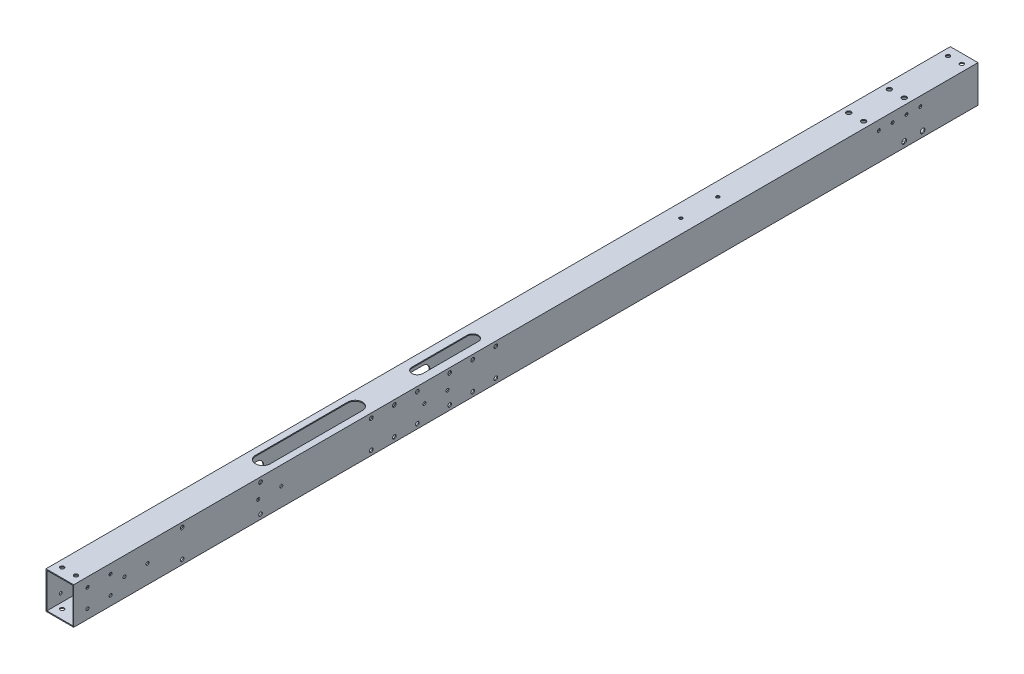
from build123d import *

# Parameters (mm, degrees)
SKETCH_1_W           = 30
SKETCH_1_H           = 40
SKETCH_1_W_2         = 28
SKETCH_1_H_2         = 38
EXTRUDE_1_DEPTH      = 940
SKETCH_5_R           = 2.5
CUT_EXTRUDE_3_DEPTH  = 941.97024395
CUT_EXTRUDE_4_DEPTH  = 1
SKETCH_7_R           = 1.5
CUT_EXTRUDE_5_DEPTH  = 1
SKETCH_17_W          = 30
SKETCH_17_H          = 40
SKETCH_17_W_2        = 28
SKETCH_17_H_2        = 38
EXTRUDE_2_DEPTH      = 20
SKETCH_18_W          = 30
SKETCH_18_H          = 40
SKETCH_18_W_2        = 28
SKETCH_18_H_2        = 38
EXTRUDE_3_DEPTH      = 20
SKETCH_19_R          = 2.1
CUT_EXTRUDE_16_DEPTH = 961.950050731
SKETCH_20_R          = 1.6
CUT_EXTRUDE_17_DEPTH = 961.67684473
SKETCH_21_R          = 2.5
SKETCH_21_R_2        = 1.6
CUT_EXTRUDE_18_DEPTH = 961.67684473
SKETCH_23_R          = 2.5
CUT_EXTRUDE_19_DEPTH = 961.950050731
SKETCH_24_R          = 4.5
CUT_EXTRUDE_20_DEPTH = 10
SKETCH_25_W          = 114.67616049
SKETCH_25_H          = 1154.562704257
CUT_EXTRUDE_21_DEPTH = 968.690549711
SKETCH_26_R          = 2
CUT_EXTRUDE_22_DEPTH = 961.67684473
CUT_EXTRUDE_23_DEPTH = 10
SKETCH_29_R          = 1.5
CUT_EXTRUDE_25_DEPTH = 10
CUT_EXTRUDE_26_DEPTH = 10
SKETCH_31_R          = 1.75
CUT_EXTRUDE_27_DEPTH = 10
SKETCH_34_W          = 70
SKETCH_34_H          = 15
CUT_EXTRUDE_28_DEPTH = 10
EXTRUDE_4_DEPTH      = 1
SKETCH_36_W          = 50.706907747
SKETCH_36_H          = 15.381529857
EXTRUDE_5_DEPTH      = 1
FILLET_1_R           = 3
SKETCH_37_R          = 1.75
CUT_EXTRUDE_29_DEPTH = 81
SKETCH_39_W          = 33.04876618
SKETCH_39_H          = 8.235453061
SKETCH_39_W_2        = 28.839368921
SKETCH_39_H_2        = 9.938064258
EXTRUDE_6_DEPTH      = 1
SKETCH_41_W          = 53.968695117
SKETCH_41_H          = 20.437849039
SKETCH_41_W_2        = 57.741002254
SKETCH_41_H_2        = 19.227533359
EXTRUDE_7_DEPTH      = 1
SKETCH_38_R          = 1.65
CUT_EXTRUDE_30_DEPTH = 93
CUT_EXTRUDE_31_DEPTH = 1
SKETCH_43_R          = 1.15
CUT_EXTRUDE_32_DEPTH = 1


with BuildPart() as part:
    # 草图1 → 凸台-拉伸1 (new body)
    with BuildSketch(Plane.XY):
        Rectangle(SKETCH_1_W, SKETCH_1_H)
        Rectangle(SKETCH_1_W_2, SKETCH_1_H_2, mode=Mode.SUBTRACT)
    extrude(amount=EXTRUDE_1_DEPTH)

    # 草图5 → 切除-拉伸3 (cut, through all)
    with BuildSketch(Plane.XZ.offset(20)):
        with Locations((-8, 53)):
            Circle(SKETCH_5_R)
        with Locations((8, 53)):
            Circle(SKETCH_5_R)
        with Locations((-8, 97)):
            Circle(SKETCH_5_R)
        with Locations((8, 97)):
            Circle(SKETCH_5_R)
    extrude(amount=-CUT_EXTRUDE_3_DEPTH, mode=Mode.SUBTRACT)

    # 草图6 → 切除-拉伸4 (cut)
    with BuildSketch(Plane(origin=(15, 0, 0), x_dir=(0, 0, -1), z_dir=(1, 0, 0))):
        with BuildLine():
            Line((-345, -7.5), (-375, -7.5))
            ThreePointArc((-375, -7.5), (-382.5, 0), (-375, 7.5))
            Line((-375, 7.5), (-345, 7.5))
            ThreePointArc((-345, 7.5), (-337.5, 0), (-345, -7.5))
        make_face()
        with BuildLine():
            Line((-525, -7.5), (-555, -7.5))
            ThreePointArc((-555, -7.5), (-562.5, 0), (-555, 7.5))
            Line((-555, 7.5), (-525, 7.5))
            ThreePointArc((-525, 7.5), (-517.5, 0), (-525, -7.5))
        make_face()
        with BuildLine():
            Line((-705, -7.5), (-735, -7.5))
            ThreePointArc((-735, -7.5), (-742.5, 0), (-735, 7.5))
            Line((-735, 7.5), (-705, 7.5))
            ThreePointArc((-705, 7.5), (-697.5, 0), (-705, -7.5))
        make_face()
    extrude(amount=-CUT_EXTRUDE_4_DEPTH, mode=Mode.SUBTRACT)

    # 草图7 → 切除-拉伸5 (cut)
    with BuildSketch(Plane.ZY.offset(15)):
        with Locations((350, 0)):
            Circle(SKETCH_7_R)
        with Locations((370, 0)):
            Circle(SKETCH_7_R)
        with Locations((530, 0)):
            Circle(SKETCH_7_R)
        with Locations((550, 0)):
            Circle(SKETCH_7_R)
        with Locations((710, 0)):
            Circle(SKETCH_7_R)
        with Locations((730, 0)):
            Circle(SKETCH_7_R)
    extrude(amount=-CUT_EXTRUDE_5_DEPTH, mode=Mode.SUBTRACT)

    # 草图17 → 凸台-拉伸2 (add)
    with BuildSketch(Plane.XY.offset(940)):
        Rectangle(SKETCH_17_W, SKETCH_17_H)
        Rectangle(SKETCH_17_W_2, SKETCH_17_H_2, mode=Mode.SUBTRACT)
    extrude(amount=EXTRUDE_2_DEPTH)

    # 草图18 → 凸台-拉伸3 (add)
    with BuildSketch(Plane(origin=(0, 0, 0), x_dir=(-1, 0, 0), z_dir=(0, 0, -1))):
        Rectangle(SKETCH_18_W, SKETCH_18_H)
        Rectangle(SKETCH_18_W_2, SKETCH_18_H_2, mode=Mode.SUBTRACT)
    extrude(amount=EXTRUDE_3_DEPTH)

    # 草图19 → 切除-拉伸16 (cut, through all)
    with BuildSketch(Plane(origin=(0, 20, 0), x_dir=(1, 0, 0), z_dir=(0, 1, 0))):
        with Locations((-7.5, -950)):
            Circle(SKETCH_19_R)
        with Locations((7.5, -950)):
            Circle(SKETCH_19_R)
        with Locations((-7.5, 10)):
            Circle(SKETCH_19_R)
        with Locations((7.5, 10)):
            Circle(SKETCH_19_R)
    extrude(amount=-CUT_EXTRUDE_16_DEPTH, mode=Mode.SUBTRACT)

    # 草图20 → 切除-拉伸17 (cut, through all)
    with BuildSketch(Plane(origin=(15, 0, 0), x_dir=(0, 0, -1), z_dir=(1, 0, 0))):
        with Locations((-945, 10)):
            Circle(SKETCH_20_R)
        with Locations((-920, 10)):
            Circle(SKETCH_20_R)
        with Locations((-920, -10)):
            Circle(SKETCH_20_R)
        with Locations((-945, -10)):
            Circle(SKETCH_20_R)
    extrude(amount=-CUT_EXTRUDE_17_DEPTH, mode=Mode.SUBTRACT)

    # 草图21 → 切除-拉伸18 (cut, through all)
    with BuildSketch(Plane(origin=(15, 0, 0), x_dir=(0, 0, -1), z_dir=(1, 0, 0))):
        with Locations((-40, -14)):
            Circle(SKETCH_21_R)
        with Locations((-60, -14)):
            Circle(SKETCH_21_R)
        with Locations((-42.5, 10)):
            Circle(SKETCH_21_R_2)
        with Locations((-57.5, 10)):
            Circle(SKETCH_21_R_2)
        with Locations((-72.5, 10)):
            Circle(SKETCH_21_R_2)
        with Locations((-87.5, 10)):
            Circle(SKETCH_21_R_2)
    extrude(amount=-CUT_EXTRUDE_18_DEPTH, mode=Mode.SUBTRACT)

    # 草图23 → 切除-拉伸19 (cut, through all)
    with BuildSketch(Plane(origin=(0, 20, 0), x_dir=(1, 0, 0), z_dir=(0, 1, 0))):
        with Locations((0, -520)):
            Circle(SKETCH_23_R)
        with Locations((0, -535)):
            Circle(SKETCH_23_R)
        with Locations((0, -550)):
            Circle(SKETCH_23_R)
        with Locations((0, -565)):
            Circle(SKETCH_23_R)
    extrude(amount=-CUT_EXTRUDE_19_DEPTH, mode=Mode.SUBTRACT)

    # 草图24 → 切除-拉伸20 (cut)
    with BuildSketch(Plane(origin=(0, 20, 0), x_dir=(1, 0, 0), z_dir=(0, 1, 0))):
        with Locations((0, -520)):
            Circle(SKETCH_24_R)
        with Locations((0, -535)):
            Circle(SKETCH_24_R)
        with Locations((0, -550)):
            Circle(SKETCH_24_R)
        with Locations((0, -565)):
            Circle(SKETCH_24_R)
    extrude(amount=-CUT_EXTRUDE_20_DEPTH, mode=Mode.SUBTRACT)


with BuildPart() as body_2:
    # 镜向2: mirrored copy
    add(part.part.mirror(Plane(origin=(-50, 0, 0), x_dir=(0, 0, 1), z_dir=(1, 0, 0))))

    # 草图26 → 切除-拉伸22 (cut, through all)
    with BuildSketch(Plane.ZY.offset(115)):
        with Locations((612.5, 15)):
            Circle(SKETCH_26_R)
        with Locations((612.5, -15)):
            Circle(SKETCH_26_R)
        with Locations((527.5, 15)):
            Circle(SKETCH_26_R)
        with Locations((527.5, -15)):
            Circle(SKETCH_26_R)
        with Locations((842.5, 15)):
            Circle(SKETCH_26_R)
        with Locations((842.5, -15)):
            Circle(SKETCH_26_R)
        with Locations((757.5, 15)):
            Circle(SKETCH_26_R)
        with Locations((757.5, -15)):
            Circle(SKETCH_26_R)
        with Locations((637.5, 15)):
            Circle(SKETCH_26_R)
        with Locations((637.5, -15)):
            Circle(SKETCH_26_R)
        with Locations((552.5, -15)):
            Circle(SKETCH_26_R)
        with Locations((552.5, 15)):
            Circle(SKETCH_26_R)
        with Locations((502.5, 15)):
            Circle(SKETCH_26_R)
        with Locations((502.5, -15)):
            Circle(SKETCH_26_R)
        with Locations((587.5, -15)):
            Circle(SKETCH_26_R)
        with Locations((587.5, 15)):
            Circle(SKETCH_26_R)
    extrude(amount=-CUT_EXTRUDE_22_DEPTH, mode=Mode.SUBTRACT)

    # 草图27 → 切除-拉伸23 (cut)
    with BuildSketch(Plane(origin=(0, 20, 0), x_dir=(1, 0, 0), z_dir=(0, 1, 0))):
        with BuildLine():
            Line((-94, -512.5), (-94, -572.5))
            ThreePointArc((-94, -572.5), (-100, -578.5), (-106, -572.5))
            Line((-106, -572.5), (-106, -512.5))
            ThreePointArc((-106, -512.5), (-100, -506.5), (-94, -512.5))
        make_face()
    extrude(amount=-CUT_EXTRUDE_23_DEPTH, mode=Mode.SUBTRACT)

    # 草图29 → 切除-拉伸25 (cut)
    with BuildSketch(Plane.XZ.offset(20)):
        with Locations((-105, 740)):
            Circle(SKETCH_29_R)
        with Locations((-105, 720)):
            Circle(SKETCH_29_R)
        with Locations((-105, 700)):
            Circle(SKETCH_29_R)
        with Locations((-105, 680)):
            Circle(SKETCH_29_R)
        with Locations((-105, 660)):
            Circle(SKETCH_29_R)
        with Locations((-105, 640)):
            Circle(SKETCH_29_R)
        with Locations((-105, 620)):
            Circle(SKETCH_29_R)
    extrude(amount=-CUT_EXTRUDE_25_DEPTH, mode=Mode.SUBTRACT)

    # 草图30 → 切除-拉伸26 (cut)
    with BuildSketch(Plane(origin=(0, 20, 0), x_dir=(1, 0, 0), z_dir=(0, 1, 0))):
        with BuildLine():
            Line((-92, -640), (-92, -740))
            ThreePointArc((-92, -740), (-100, -748), (-108, -740))
            Line((-108, -740), (-108, -640))
            ThreePointArc((-108, -640), (-100, -632), (-92, -640))
        make_face()
    extrude(amount=-CUT_EXTRUDE_26_DEPTH, mode=Mode.SUBTRACT)

    # 草图31 → 切除-拉伸27 (cut)
    with BuildSketch(Plane.XZ.offset(20)):
        with Locations((-100, 137)):
            Circle(SKETCH_31_R)
        with Locations((-100, 177)):
            Circle(SKETCH_31_R)
    extrude(amount=-CUT_EXTRUDE_27_DEPTH, mode=Mode.SUBTRACT)

    # 草图34 → 切除-拉伸28 (cut)
    with BuildSketch(Plane.ZY.offset(115)):
        with Locations((265, -11.5)):
            Rectangle(SKETCH_34_W, SKETCH_34_H)
    extrude(amount=-CUT_EXTRUDE_28_DEPTH, mode=Mode.SUBTRACT)

    # 草图35 → 凸台-拉伸4 (add)
    with BuildSketch(Plane.ZY.offset(115)):
        Polygon((336.145770334, -4), (350, -4), (350, -9.077366936), (391.920925018, -9.077366936), (391.920925018, 11.093373936), (336.145770334, 11.093373936), align=None)
    extrude(amount=-EXTRUDE_4_DEPTH)

    # 草图36 → 凸台-拉伸5 (add)
    with BuildSketch(Plane(origin=(-85, 0, 0), x_dir=(0, 0, -1), z_dir=(1, 0, 0))):
        with Locations((-354.422343157, -1.974054468)):
            Rectangle(SKETCH_36_W, SKETCH_36_H)
    extrude(amount=-EXTRUDE_5_DEPTH)

    # 圆角1
    fillet_1_edges = [body_2.edges().sort_by_distance(p)[0] for p in [
        (-114.5, -19, 300),
        (-114.5, -4, 300),
        (-114.5, -4, 230),
        (-114.5, -19, 230),
    ]]
    fillet(fillet_1_edges, radius=FILLET_1_R)

    # 草图37 → 切除-拉伸29 (cut)
    with BuildSketch(Plane.XZ.offset(20)):
        with Locations((-100, 247)):
            Circle(SKETCH_37_R)
        with Locations((-100, 287)):
            Circle(SKETCH_37_R)
    extrude(amount=-CUT_EXTRUDE_29_DEPTH, mode=Mode.SUBTRACT)

    # 草图39 → 凸台-拉伸6 (add)
    with BuildSketch(Plane(origin=(-85, 0, 0), x_dir=(0, 0, -1), z_dir=(1, 0, 0))):
        with Locations((-716.005404382, 0.278572404)):
            Rectangle(SKETCH_39_W, SKETCH_39_H)
        with Locations((-538.020368458, 0.344207478)):
            Rectangle(SKETCH_39_W_2, SKETCH_39_H_2)
    extrude(amount=-EXTRUDE_6_DEPTH)

    # 草图41 → 凸台-拉伸7 (add)
    with BuildSketch(Plane.ZY.offset(115)):
        with Locations((541.407114178, 0.400095075)):
            Rectangle(SKETCH_41_W, SKETCH_41_H)
        with Locations((717.500112012, 1.005252915)):
            Rectangle(SKETCH_41_W_2, SKETCH_41_H_2)
    extrude(amount=-EXTRUDE_7_DEPTH)

    # 草图38 → 切除-拉伸30 (cut)
    with BuildSketch(Plane(origin=(-85, 0, 0), x_dir=(0, 0, -1), z_dir=(1, 0, 0))):
        with Locations((-905, 0)):
            Circle(SKETCH_38_R)
        with Locations((-880, 0)):
            Circle(SKETCH_38_R)
        with Locations((-760, 0)):
            Circle(SKETCH_38_R)
        with Locations((-735, 0)):
            Circle(SKETCH_38_R)
        with Locations((-580, 0)):
            Circle(SKETCH_38_R)
        with Locations((-555, 0)):
            Circle(SKETCH_38_R)
    extrude(amount=-CUT_EXTRUDE_30_DEPTH, mode=Mode.SUBTRACT)

    # 草图42 → 切除-拉伸31 (cut)
    with BuildSketch(Plane.ZY.offset(115)):
        with BuildLine():
            Line((877.5, 7.5), (907.5, 7.5))
            ThreePointArc((907.5, 7.5), (915, 0), (907.5, -7.5))
            Line((907.5, -7.5), (877.5, -7.5))
            ThreePointArc((877.5, -7.5), (870, 0), (877.5, 7.5))
        make_face()
        with BuildLine():
            Line((732.5, 7.5), (762.5, 7.5))
            ThreePointArc((762.5, 7.5), (770, 0), (762.5, -7.5))
            Line((762.5, -7.5), (732.5, -7.5))
            ThreePointArc((732.5, -7.5), (725, 0), (732.5, 7.5))
        make_face()
        with BuildLine():
            Line((552.5, 7.5), (582.5, 7.5))
            ThreePointArc((582.5, 7.5), (590, 0), (582.5, -7.5))
            Line((582.5, -7.5), (552.5, -7.5))
            ThreePointArc((552.5, -7.5), (545, 0), (552.5, 7.5))
        make_face()
    extrude(amount=-CUT_EXTRUDE_31_DEPTH, mode=Mode.SUBTRACT)

    # 草图43 → 切除-拉伸32 (cut)
    with BuildSketch(Plane.ZY.offset(115)):
        with Locations((-14, 9)):
            Circle(SKETCH_43_R)
        with Locations((31.2, 9)):
            Circle(SKETCH_43_R)
        with Locations((31.2, -9)):
            Circle(SKETCH_43_R)
        with Locations((-14, -9)):
            Circle(SKETCH_43_R)
    extrude(amount=-CUT_EXTRUDE_32_DEPTH, mode=Mode.SUBTRACT)


with BuildPart() as part_1:
    add(part.part)

    # 草图25 → 切除-拉伸21 (cut, through all)
    with BuildSketch(Plane(origin=(0, 20, 0), x_dir=(1, 0, 0), z_dir=(0, 1, 0))):
        with Locations((7.338080245, -506.215166959)):
            Rectangle(SKETCH_25_W, SKETCH_25_H)
    extrude(amount=-CUT_EXTRUDE_21_DEPTH, mode=Mode.SUBTRACT)


solid = body_2.part
